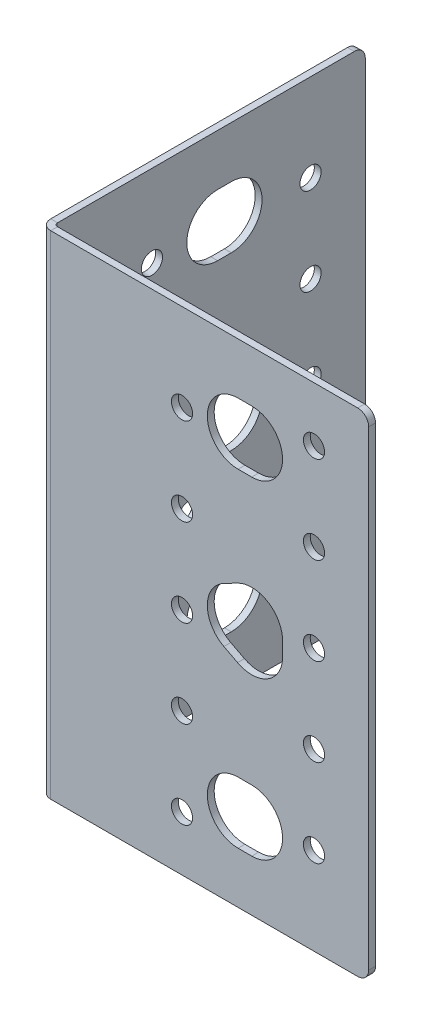
from build123d import *

# Parameters (mm, degrees)
SKETCH1_W          = 73.81875
SKETCH1_H          = 114.3
BASE_FLANGE1_DEPTH = 1.5875
EDGE_FLANGE1_DEPTH = 114.3
SKETCH11_R         = 2.45745
CUT_EXTRUDE1_DEPTH = 155.799566224
SKETCH12_R         = 2.45745
CUT_EXTRUDE2_DEPTH = 156.949151494
FILLET1_R          = 2.54


# Sheet-metal steps are written as plain solids
with BuildPart() as part:
    # Sketch1 → Base-Flange1 (new body)
    with BuildSketch(Plane.XY):
        with Locations((36.909375, 57.15)):
            Rectangle(SKETCH1_W, SKETCH1_H)
    extrude(amount=-BASE_FLANGE1_DEPTH)

    # Edge-Flange1 section (across the edge) → Edge-Flange1 (add)
    with BuildSketch(Plane(origin=(-0.79375, 0, -1.5875), x_dir=(1, 0, 0), z_dir=(0, 1, 0))):
        with BuildLine():
            Line((-1.5875, 0.79375), (-1.5875, 72.23125))
            Line((-1.5875, 72.23125), (0, 72.23125))
            Line((0, 72.23125), (0, 0.79375))
            ThreePointArc((0, 0.79375), (0.232483992, 0.232483992), (0.79375, 0))
            Line((0.79375, 0), (0.79375, -1.5875))
            ThreePointArc((0.79375, -1.5875), (-0.890048023, -0.890048023), (-1.5875, 0.79375))
        make_face()
    extrude(amount=EDGE_FLANGE1_DEPTH)

    # Sketch11 → Cut-Extrude1 (cut, through all)
    with BuildSketch(Plane.XY):
        with Locations((30.48, 12.7)):
            Circle(SKETCH11_R)
        with Locations((30.48, 33.02)):
            Circle(SKETCH11_R)
        with Locations((30.48, 53.34)):
            Circle(SKETCH11_R)
        with Locations((30.48, 73.66)):
            Circle(SKETCH11_R)
        with Locations((30.48, 93.98)):
            Circle(SKETCH11_R)
        with Locations((61.11875, 101.6)):
            Circle(SKETCH11_R)
        with Locations((61.11875, 81.28)):
            Circle(SKETCH11_R)
        with Locations((61.11875, 60.96)):
            Circle(SKETCH11_R)
        with Locations((61.11875, 40.64)):
            Circle(SKETCH11_R)
        with Locations((61.11875, 20.32)):
            Circle(SKETCH11_R)
        with BuildLine():
            Line((46.67885, 88.10625), (43.50385, 88.10625))
            ThreePointArc((43.50385, 88.10625), (36.3601, 95.25), (43.50385, 102.39375))
            Line((43.50385, 102.39375), (46.67885, 102.39375))
            ThreePointArc((46.67885, 102.39375), (53.8226, 95.25), (46.67885, 88.10625))
        make_face()
        with BuildLine():
            Line((46.67885, 11.90625), (43.50385, 11.90625))
            ThreePointArc((43.50385, 11.90625), (36.3601, 19.05), (43.50385, 26.19375))
            Line((43.50385, 26.19375), (46.67885, 26.19375))
            ThreePointArc((46.67885, 26.19375), (53.8226, 19.05), (46.67885, 11.90625))
        make_face()
        with BuildLine():
            Line((43.383061388, 65.139055024), (40.208061388, 63.488055024))
            ThreePointArc((40.208061388, 63.488055024), (36.3601, 57.15), (40.208061388, 50.811944976))
            Line((40.208061388, 50.811944976), (43.383061388, 49.160944976))
            ThreePointArc((43.383061388, 49.160944976), (50.386199064, 49.392550378), (53.8226, 55.499))
            Line((53.8226, 55.499), (53.8226, 58.801))
            ThreePointArc((53.8226, 58.801), (50.386199064, 64.907449622), (43.383061388, 65.139055024))
        make_face()
    extrude(amount=-CUT_EXTRUDE1_DEPTH, mode=Mode.SUBTRACT)

    # Sketch12 → Cut-Extrude2 (cut, through all)
    with BuildSketch(Plane.ZY.offset(2.38125)):
        with Locations((-61.11875, 12.7)):
            Circle(SKETCH12_R)
        with Locations((-61.11875, 33.02)):
            Circle(SKETCH12_R)
        with Locations((-61.11875, 53.34)):
            Circle(SKETCH12_R)
        with Locations((-61.11875, 73.66)):
            Circle(SKETCH12_R)
        with Locations((-61.11875, 93.98)):
            Circle(SKETCH12_R)
        with Locations((-32.86125, 73.66)):
            Circle(SKETCH12_R)
        with Locations((-32.86125, 40.64)):
            Circle(SKETCH12_R)
        with Locations((-24.2951, 95.25)):
            Circle(SKETCH12_R)
        with Locations((-24.2951, 19.05)):
            Circle(SKETCH12_R)
        with BuildLine():
            Line((-35.56635, 58.801), (-35.56635, 55.499))
            ThreePointArc((-35.56635, 55.499), (-42.7101, 48.35525), (-49.85385, 55.499))
            Line((-49.85385, 55.499), (-49.85385, 58.801))
            ThreePointArc((-49.85385, 58.801), (-42.7101, 65.94475), (-35.56635, 58.801))
        make_face()
        with BuildLine():
            Line((-42.7101, 102.39375), (-39.5351, 102.39375))
            ThreePointArc((-39.5351, 102.39375), (-32.39135, 95.25), (-39.5351, 88.10625))
            Line((-39.5351, 88.10625), (-42.7101, 88.10625))
            ThreePointArc((-42.7101, 88.10625), (-49.85385, 95.25), (-42.7101, 102.39375))
        make_face()
        with BuildLine():
            Line((-42.7101, 26.19375), (-39.5351, 26.19375))
            ThreePointArc((-39.5351, 26.19375), (-32.39135, 19.05), (-39.5351, 11.90625))
            Line((-39.5351, 11.90625), (-42.7101, 11.90625))
            ThreePointArc((-42.7101, 11.90625), (-49.85385, 19.05), (-42.7101, 26.19375))
        make_face()
    extrude(amount=-CUT_EXTRUDE2_DEPTH, mode=Mode.SUBTRACT)

    # Fillet1
    fillet1_edges = [part.edges().sort_by_distance(p)[0] for p in [
        (-1.5875, 0, -73.81875),
        (-1.5875, 114.3, -73.81875),
        (73.81875, 114.3, -0.79375),
        (73.81875, 0, -0.79375),
    ]]
    fillet(fillet1_edges, radius=FILLET1_R)


solid = part.part
